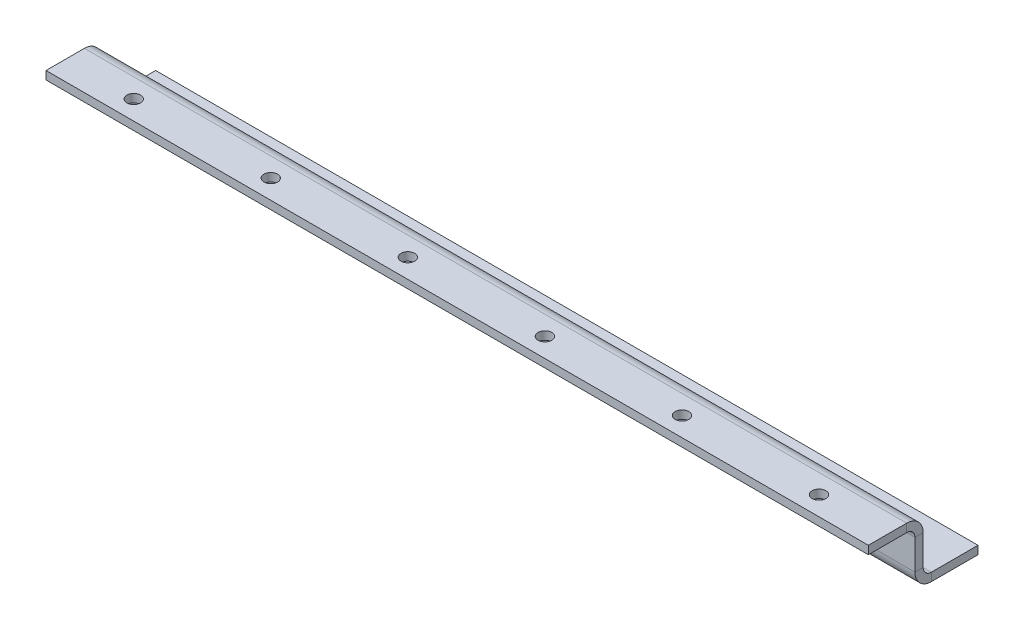
from build123d import *

# Parameters (mm, degrees)
BASE_FLANGE1_DEPTH = 300
CUT_EXTRUDE1_REACH = 303.544
SKETCH6_R          = 2.5


# Sheet-metal steps are written as plain solids
with BuildPart() as part:
    # Sketch1 → Base-Flange1 (new body)
    with BuildSketch(Plane(origin=(0, 0, 0), x_dir=(0, 0, -1), z_dir=(1, 0, 0))):
        with BuildLine():
            Line((-20, 10), (-6, 10))
            ThreePointArc((-6, 10), (-1.757359313, 8.242640687), (0, 4))
            Line((0, 4), (0, -7))
            ThreePointArc((0, -7), (0.878679656, -9.121320344), (3, -10))
            Line((3, -10), (20, -10))
            Line((20, -10), (20, -13))
            Line((20, -13), (3, -13))
            ThreePointArc((3, -13), (-1.242640687, -11.242640687), (-3, -7))
            Line((-3, -7), (-3, 4))
            ThreePointArc((-3, 4), (-3.878679656, 6.121320344), (-6, 7))
            Line((-6, 7), (-20, 7))
            Line((-20, 7), (-20, 10))
        make_face()
    extrude(amount=BASE_FLANGE1_DEPTH)

    # Sketch6 → Cut-Extrude1 (cut, up to next)
    with BuildSketch(Plane(origin=(0, 10, 0), x_dir=(1, 0, 0), z_dir=(0, 1, 0)), mode=Mode.PRIVATE) as cut_extrude1_sk1:
        with Locations(Location((25, -13, 0), (0, 0, 270))):
            Circle(SKETCH6_R)
    cut_extrude1_tool1 = extrude(cut_extrude1_sk1.sketch, amount=-CUT_EXTRUDE1_REACH, mode=Mode.PRIVATE) & part.part
    # Sketch6 → Cut-Extrude1 (cut, up to next)
    with BuildSketch(Plane(origin=(0, 10, 0), x_dir=(1, 0, 0), z_dir=(0, 1, 0)), mode=Mode.PRIVATE) as cut_extrude1_sk2:
        with Locations(Location((75, -13, 0), (0, 0, 270))):
            Circle(SKETCH6_R)
    cut_extrude1_tool2 = extrude(cut_extrude1_sk2.sketch, amount=-CUT_EXTRUDE1_REACH, mode=Mode.PRIVATE) & part.part
    # Sketch6 → Cut-Extrude1 (cut, up to next)
    with BuildSketch(Plane(origin=(0, 10, 0), x_dir=(1, 0, 0), z_dir=(0, 1, 0)), mode=Mode.PRIVATE) as cut_extrude1_sk3:
        with Locations(Location((125, -13, 0), (0, 0, 270))):
            Circle(SKETCH6_R)
    cut_extrude1_tool3 = extrude(cut_extrude1_sk3.sketch, amount=-CUT_EXTRUDE1_REACH, mode=Mode.PRIVATE) & part.part
    # Sketch6 → Cut-Extrude1 (cut, up to next)
    with BuildSketch(Plane(origin=(0, 10, 0), x_dir=(1, 0, 0), z_dir=(0, 1, 0)), mode=Mode.PRIVATE) as cut_extrude1_sk4:
        with Locations(Location((175, -13, 0), (0, 0, 270))):
            Circle(SKETCH6_R)
    cut_extrude1_tool4 = extrude(cut_extrude1_sk4.sketch, amount=-CUT_EXTRUDE1_REACH, mode=Mode.PRIVATE) & part.part
    # Sketch6 → Cut-Extrude1 (cut, up to next)
    with BuildSketch(Plane(origin=(0, 10, 0), x_dir=(1, 0, 0), z_dir=(0, 1, 0)), mode=Mode.PRIVATE) as cut_extrude1_sk5:
        with Locations(Location((225, -13, 0), (0, 0, 270))):
            Circle(SKETCH6_R)
    cut_extrude1_tool5 = extrude(cut_extrude1_sk5.sketch, amount=-CUT_EXTRUDE1_REACH, mode=Mode.PRIVATE) & part.part
    # Sketch6 → Cut-Extrude1 (cut, up to next)
    with BuildSketch(Plane(origin=(0, 10, 0), x_dir=(1, 0, 0), z_dir=(0, 1, 0)), mode=Mode.PRIVATE) as cut_extrude1_sk6:
        with Locations(Location((275, -13, 0), (0, 0, 270))):
            Circle(SKETCH6_R)
    cut_extrude1_tool6 = extrude(cut_extrude1_sk6.sketch, amount=-CUT_EXTRUDE1_REACH, mode=Mode.PRIVATE) & part.part
    # Sketch6 → Cut-Extrude1 (cut, up to next)
    with BuildSketch(Plane(origin=(0, 10, 0), x_dir=(1, 0, 0), z_dir=(0, 1, 0)), mode=Mode.PRIVATE) as cut_extrude1_sk7:
        with Locations(Location((75, 11.5, 0), (0, 0, 270))):
            Circle(SKETCH6_R)
    cut_extrude1_tool7 = extrude(cut_extrude1_sk7.sketch, amount=-CUT_EXTRUDE1_REACH, mode=Mode.PRIVATE) & part.part
    # Sketch6 → Cut-Extrude1 (cut, up to next)
    with BuildSketch(Plane(origin=(0, 10, 0), x_dir=(1, 0, 0), z_dir=(0, 1, 0)), mode=Mode.PRIVATE) as cut_extrude1_sk8:
        with Locations(Location((125, 11.5, 0), (0, 0, 270))):
            Circle(SKETCH6_R)
    cut_extrude1_tool8 = extrude(cut_extrude1_sk8.sketch, amount=-CUT_EXTRUDE1_REACH, mode=Mode.PRIVATE) & part.part
    # Sketch6 → Cut-Extrude1 (cut, up to next)
    with BuildSketch(Plane(origin=(0, 10, 0), x_dir=(1, 0, 0), z_dir=(0, 1, 0)), mode=Mode.PRIVATE) as cut_extrude1_sk9:
        with Locations(Location((175, 11.5, 0), (0, 0, 270))):
            Circle(SKETCH6_R)
    cut_extrude1_tool9 = extrude(cut_extrude1_sk9.sketch, amount=-CUT_EXTRUDE1_REACH, mode=Mode.PRIVATE) & part.part
    # Sketch6 → Cut-Extrude1 (cut, up to next)
    with BuildSketch(Plane(origin=(0, 10, 0), x_dir=(1, 0, 0), z_dir=(0, 1, 0)), mode=Mode.PRIVATE) as cut_extrude1_sk10:
        with Locations(Location((225, 11.5, 0), (0, 0, 270))):
            Circle(SKETCH6_R)
    cut_extrude1_tool10 = extrude(cut_extrude1_sk10.sketch, amount=-CUT_EXTRUDE1_REACH, mode=Mode.PRIVATE) & part.part
    # Sketch6 → Cut-Extrude1 (cut, up to next)
    with BuildSketch(Plane(origin=(0, 10, 0), x_dir=(1, 0, 0), z_dir=(0, 1, 0)), mode=Mode.PRIVATE) as cut_extrude1_sk11:
        with Locations(Location((275, 11.5, 0), (0, 0, 270))):
            Circle(SKETCH6_R)
    cut_extrude1_tool11 = extrude(cut_extrude1_sk11.sketch, amount=-CUT_EXTRUDE1_REACH, mode=Mode.PRIVATE) & part.part
    # Sketch6 → Cut-Extrude1 (cut, up to next)
    with BuildSketch(Plane(origin=(0, 10, 0), x_dir=(1, 0, 0), z_dir=(0, 1, 0)), mode=Mode.PRIVATE) as cut_extrude1_sk12:
        with Locations(Location((25, 11.5, 0), (0, 0, 270))):
            Circle(SKETCH6_R)
    cut_extrude1_tool12 = extrude(cut_extrude1_sk12.sketch, amount=-CUT_EXTRUDE1_REACH, mode=Mode.PRIVATE) & part.part
    add(cut_extrude1_tool1.solids().sort_by_distance((25, 10, 13))[0], mode=Mode.SUBTRACT)
    add(cut_extrude1_tool2.solids().sort_by_distance((75, 10, 13))[0], mode=Mode.SUBTRACT)
    add(cut_extrude1_tool3.solids().sort_by_distance((125, 10, 13))[0], mode=Mode.SUBTRACT)
    add(cut_extrude1_tool4.solids().sort_by_distance((175, 10, 13))[0], mode=Mode.SUBTRACT)
    add(cut_extrude1_tool5.solids().sort_by_distance((225, 10, 13))[0], mode=Mode.SUBTRACT)
    add(cut_extrude1_tool6.solids().sort_by_distance((275, 10, 13))[0], mode=Mode.SUBTRACT)
    add(cut_extrude1_tool7.solids().sort_by_distance((75, 10, -11.5))[0], mode=Mode.SUBTRACT)
    add(cut_extrude1_tool8.solids().sort_by_distance((125, 10, -11.5))[0], mode=Mode.SUBTRACT)
    add(cut_extrude1_tool9.solids().sort_by_distance((175, 10, -11.5))[0], mode=Mode.SUBTRACT)
    add(cut_extrude1_tool10.solids().sort_by_distance((225, 10, -11.5))[0], mode=Mode.SUBTRACT)
    add(cut_extrude1_tool11.solids().sort_by_distance((275, 10, -11.5))[0], mode=Mode.SUBTRACT)
    add(cut_extrude1_tool12.solids().sort_by_distance((25, 10, -11.5))[0], mode=Mode.SUBTRACT)


solid = part.part
